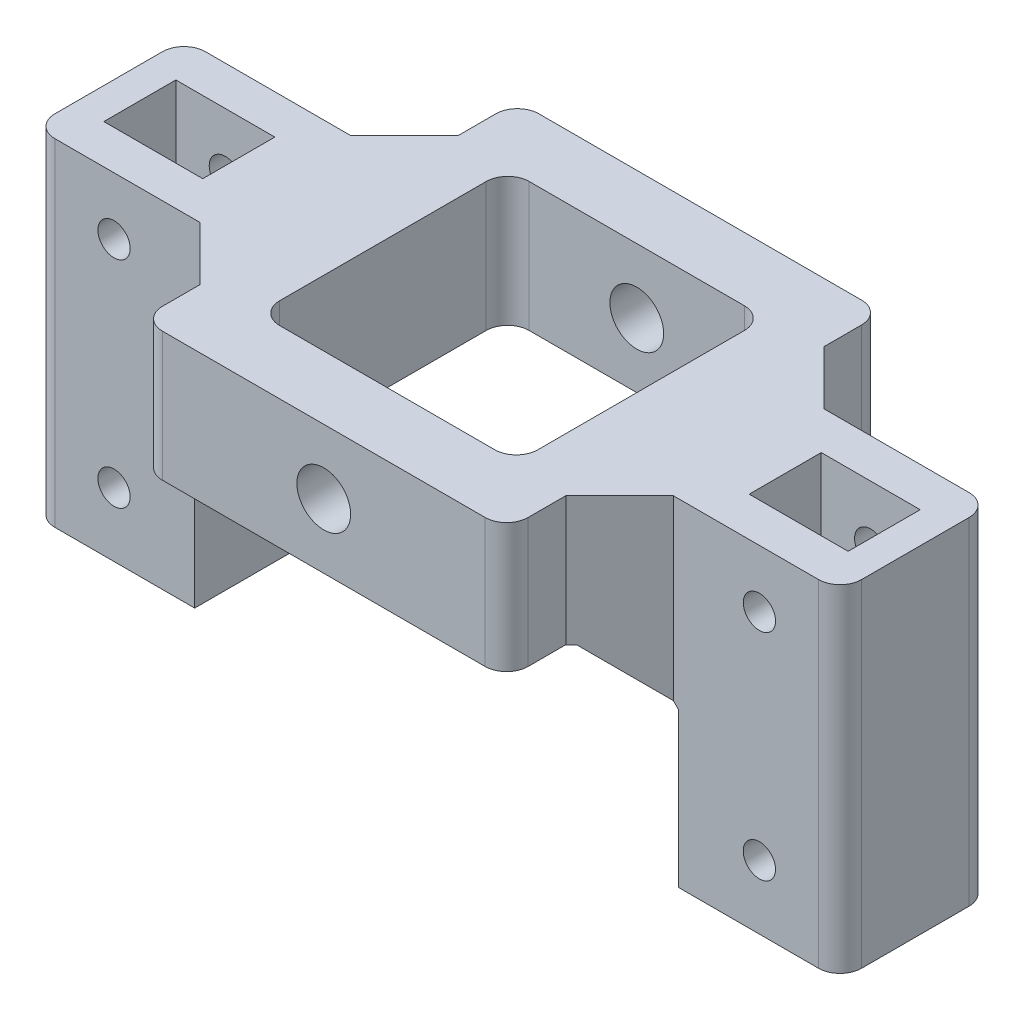
from build123d import *

# Parameters (mm, degrees)
EXTRUDE_1_DEPTH        = 7
EXTRUDE_1_DEPTH_BACK   = 7
SKETCH_1_W             = 15
SKETCH_1_H             = 34.3
EXTRUDE_1_2_DEPTH      = 7
EXTRUDE_1_2_DEPTH_BACK = 7
SKETCH_2_W             = 9.2
SKETCH_2_H             = 6.7
CUT_EXTRUDE_1_DEPTH    = 62
SKETCH_3_W             = 24
SKETCH_3_H             = 23.2
EXTRUDE_2_DEPTH        = 12
SKETCH_4_R             = 2.5
CUT_EXTRUDE_2_DEPTH    = 90
FILLET_1_R             = 2
CHAMFER_1_SIZE         = 5
CHAMFER_2_SIZE         = 5
FILLET_2_R             = 2
SKETCH_7_R             = 1.5
CUT_EXTRUDE_3_DEPTH    = 34
SKETCH_9_W             = 15
SKETCH_9_H             = 3
CUT_EXTRUDE_4_DEPTH    = 34


with BuildPart() as part:
    # 草图1 → 凸台-拉伸1 (new, two sides: drawn at the far end of the back side and taken through both)
    with BuildSketch(Plane.XY.offset(-EXTRUDE_1_DEPTH_BACK)):
        with Locations((30, 0)):
            Rectangle(SKETCH_1_W, SKETCH_1_H)
    extrude(amount=EXTRUDE_1_DEPTH + EXTRUDE_1_DEPTH_BACK)


with BuildPart() as body_2:
    # 草图1 → Extrude 1 2 (new, two sides: drawn at the far end of the back side and taken through both)
    with BuildSketch(Plane.XY.offset(-EXTRUDE_1_2_DEPTH_BACK)):
        with Locations((-30, 0)):
            Rectangle(SKETCH_1_W, SKETCH_1_H)
    extrude(amount=EXTRUDE_1_2_DEPTH + EXTRUDE_1_2_DEPTH_BACK)


with BuildPart() as cut_extrude_1_tool:
    # 草图2 → 切除-拉伸1 (new body)
    with BuildSketch(Plane(origin=(0, 17.15, 0), x_dir=(1, 0, 0), z_dir=(0, 1, 0))):
        with Locations((30, 0)):
            Rectangle(SKETCH_2_W, SKETCH_2_H)
        with Locations((-30, 0)):
            Rectangle(SKETCH_2_W, SKETCH_2_H)
    extrude(amount=-CUT_EXTRUDE_1_DEPTH)


with BuildPart() as part_1:
    add(part.part)

    # 切除-拉伸1: cut by cut_extrude_1_tool
    add(cut_extrude_1_tool.part, mode=Mode.SUBTRACT)



with BuildPart() as body_2_1:
    add(body_2.part)

    # 切除-拉伸1: cut by cut_extrude_1_tool
    add(cut_extrude_1_tool.part, mode=Mode.SUBTRACT)


with BuildPart() as part_2:
    add(part_1.part)

    add(body_2_1.part)  # 凸台-拉伸2 merges body 2
    # 草图3 → 凸台-拉伸2 (add)
    with BuildSketch(Plane(origin=(0, 17.15, 0), x_dir=(1, 0, 0), z_dir=(0, 1, 0))):
        Polygon((22.5, 7), (17, 7), (17, 17.5), (-17, 17.5), (-17, 7), (-22.5, 7), (-22.5, -7), (-17, -7), (-17, -17.5), (17, -17.5), (17, -7), (22.5, -7), align=None)
        Rectangle(SKETCH_3_W, SKETCH_3_H, mode=Mode.SUBTRACT)
    extrude(amount=-EXTRUDE_2_DEPTH)

    # 草图4 → 切除-拉伸2 (cut)
    with BuildSketch(Plane.XY.offset(17.5)):
        with Locations((0, 11.15)):
            Circle(SKETCH_4_R)
    extrude(amount=-CUT_EXTRUDE_2_DEPTH, mode=Mode.SUBTRACT)

    # 圆角1
    fillet_1_edges = [part_2.edges().sort_by_distance(p)[0] for p in [
        (-37.5, 0, -7),
        (-37.5, 0, 7),
        (37.5, 0, 7),
        (37.5, 0, -7),
    ]]
    fillet(fillet_1_edges, radius=FILLET_1_R)

    # 倒角1
    chamfer_1_edges = [part_2.edges().sort_by_distance(p)[0] for p in [
        (22.5, 5.15, 0),
        (-22.5, 5.15, 0),
    ]]
    chamfer(chamfer_1_edges, length=CHAMFER_1_SIZE)

    # 倒角2
    # the kernel refuses this chamfer: 5 mm, written as the material it adds along each edge
    with BuildSketch(Plane(origin=(17, 17.15, -7), x_dir=(0.9996219169112968, 0, 0.027495876610586147), z_dir=(0, -1, 0))) as chamfer_2_piece_1_section:
        Polygon((CHAMFER_2_SIZE * 0.999621916911, -CHAMFER_2_SIZE * 0.0274958766106), (-CHAMFER_2_SIZE * 0.0274958766106, -CHAMFER_2_SIZE * 0.999621916911), (0, 0), align=None)
    chamfer_2_piece_1 = extrude(amount=12, mode=Mode.PRIVATE)
    chamfer_2_piece_1 = split(chamfer_2_piece_1, bisect_by=Plane(origin=(15.061953737, 7.588046263, -8.643148294), z_dir=(0.7071067811865476, 0.7071067811865475, 0)), keep=Keep.TOP, mode=Mode.PRIVATE)
    add(chamfer_2_piece_1)
    with BuildSketch(Plane(origin=(17, 17.15, -7), x_dir=(0.9996219169112968, 0, 0.027495876610586147), z_dir=(0, -1, 0))) as chamfer_2_piece_2_section:
        Polygon((CHAMFER_2_SIZE * 0.999621916911, -CHAMFER_2_SIZE * 0.0274958766106), (-CHAMFER_2_SIZE * 0.0274958766106, -CHAMFER_2_SIZE * 0.999621916911), (0, 0), align=None)
    chamfer_2_piece_2 = extrude(amount=12, mode=Mode.PRIVATE)
    chamfer_2_piece_2 = split(chamfer_2_piece_2, bisect_by=Plane(origin=(17.181894142, 5.468105858, -9.627776216), z_dir=(-0.7071067811865476, -0.7071067811865475, 0)), keep=Keep.TOP, mode=Mode.PRIVATE)
    add(chamfer_2_piece_2)
    with BuildSketch(Plane(origin=(17, 17.15, -7), x_dir=(0.9996219169112968, 0, 0.027495876610586147), z_dir=(0, -1, 0))) as chamfer_2_piece_3_section:
        Polygon((CHAMFER_2_SIZE * 0.999621916911, -CHAMFER_2_SIZE * 0.0274958766106), (-CHAMFER_2_SIZE * 0.0274958766106, -CHAMFER_2_SIZE * 0.999621916911), (0, 0), align=None)
    chamfer_2_piece_3 = extrude(amount=24.85841494, mode=Mode.PRIVATE)
    chamfer_2_piece_3 = split(chamfer_2_piece_3, bisect_by=Plane(origin=(19.269171179, 3.380828821, -8.010149173), z_dir=(0.7071067811865476, 0.7071067811865475, 0)), keep=Keep.TOP, mode=Mode.PRIVATE)
    chamfer_2_piece_3 = split(chamfer_2_piece_3, bisect_by=Plane(origin=(19.858894906, 5.15, -8.010149173), z_dir=(0, -1, 0)), keep=Keep.TOP, mode=Mode.PRIVATE)
    add(chamfer_2_piece_3)
    with BuildSketch(Plane(origin=(-17, 17.15, -7), x_dir=(0.027495876610586313, 0, -0.9996219169112968), z_dir=(0, -1, 0))) as chamfer_2_piece_4_section:
        Polygon((CHAMFER_2_SIZE * 0.999621916911, -CHAMFER_2_SIZE * 0.0274958766106), (-CHAMFER_2_SIZE * 0.0274958766106, -CHAMFER_2_SIZE * 0.999621916911), (0, 0), align=None)
    chamfer_2_piece_4 = extrude(amount=12, mode=Mode.PRIVATE)
    chamfer_2_piece_4 = split(chamfer_2_piece_4, bisect_by=Plane(origin=(-15.061953737, 7.588046263, -8.643148294), z_dir=(-0.7071067811865475, 0.7071067811865476, 0)), keep=Keep.TOP, mode=Mode.PRIVATE)
    add(chamfer_2_piece_4)
    with BuildSketch(Plane(origin=(-17, 17.15, -7), x_dir=(0.027495876610586313, 0, -0.9996219169112968), z_dir=(0, -1, 0))) as chamfer_2_piece_5_section:
        Polygon((CHAMFER_2_SIZE * 0.999621916911, -CHAMFER_2_SIZE * 0.0274958766106), (-CHAMFER_2_SIZE * 0.0274958766106, -CHAMFER_2_SIZE * 0.999621916911), (0, 0), align=None)
    chamfer_2_piece_5 = extrude(amount=24.85841494, mode=Mode.PRIVATE)
    chamfer_2_piece_5 = split(chamfer_2_piece_5, bisect_by=Plane(origin=(-19.858894906, 5.15, -8.010149173), z_dir=(0, -1, 0)), keep=Keep.TOP, mode=Mode.PRIVATE)
    chamfer_2_piece_5 = split(chamfer_2_piece_5, bisect_by=Plane(origin=(-19.269171179, 3.380828821, -8.010149173), z_dir=(-0.7071067811865475, 0.7071067811865476, 0)), keep=Keep.TOP, mode=Mode.PRIVATE)
    add(chamfer_2_piece_5)
    with BuildSketch(Plane(origin=(-17, 17.15, -7), x_dir=(0.027495876610586313, 0, -0.9996219169112968), z_dir=(0, -1, 0))) as chamfer_2_piece_6_section:
        Polygon((CHAMFER_2_SIZE * 0.999621916911, -CHAMFER_2_SIZE * 0.0274958766106), (-CHAMFER_2_SIZE * 0.0274958766106, -CHAMFER_2_SIZE * 0.999621916911), (0, 0), align=None)
    chamfer_2_piece_6 = extrude(amount=12, mode=Mode.PRIVATE)
    chamfer_2_piece_6 = split(chamfer_2_piece_6, bisect_by=Plane(origin=(-17.181894142, 5.468105858, -9.627776216), z_dir=(0.7071067811865475, -0.7071067811865476, 0)), keep=Keep.TOP, mode=Mode.PRIVATE)
    add(chamfer_2_piece_6)
    with BuildSketch(Plane(origin=(17, 17.15, 7), x_dir=(0.9996219169112968, 0, -0.027495876610586147), z_dir=(0, -1, 0))) as chamfer_2_piece_7_section:
        Polygon((CHAMFER_2_SIZE * 0.999621916911, CHAMFER_2_SIZE * 0.0274958766106), (-CHAMFER_2_SIZE * 0.0274958766106, CHAMFER_2_SIZE * 0.999621916911), (0, 0), align=None)
    chamfer_2_piece_7 = extrude(amount=12, mode=Mode.PRIVATE)
    chamfer_2_piece_7 = split(chamfer_2_piece_7, bisect_by=Plane(origin=(15.061953737, 7.588046263, 8.643148294), z_dir=(0.7071067811865476, 0.7071067811865475, 0)), keep=Keep.TOP, mode=Mode.PRIVATE)
    add(chamfer_2_piece_7)
    with BuildSketch(Plane(origin=(17, 17.15, 7), x_dir=(0.9996219169112968, 0, -0.027495876610586147), z_dir=(0, -1, 0))) as chamfer_2_piece_8_section:
        Polygon((CHAMFER_2_SIZE * 0.999621916911, CHAMFER_2_SIZE * 0.0274958766106), (-CHAMFER_2_SIZE * 0.0274958766106, CHAMFER_2_SIZE * 0.999621916911), (0, 0), align=None)
    chamfer_2_piece_8 = extrude(amount=12, mode=Mode.PRIVATE)
    chamfer_2_piece_8 = split(chamfer_2_piece_8, bisect_by=Plane(origin=(17.181894142, 5.468105858, 9.627776216), z_dir=(-0.7071067811865476, -0.7071067811865475, 0)), keep=Keep.TOP, mode=Mode.PRIVATE)
    add(chamfer_2_piece_8)
    with BuildSketch(Plane(origin=(17, 17.15, 7), x_dir=(0.9996219169112968, 0, -0.027495876610586147), z_dir=(0, -1, 0))) as chamfer_2_piece_9_section:
        Polygon((CHAMFER_2_SIZE * 0.999621916911, CHAMFER_2_SIZE * 0.0274958766106), (-CHAMFER_2_SIZE * 0.0274958766106, CHAMFER_2_SIZE * 0.999621916911), (0, 0), align=None)
    chamfer_2_piece_9 = extrude(amount=24.85841494, mode=Mode.PRIVATE)
    chamfer_2_piece_9 = split(chamfer_2_piece_9, bisect_by=Plane(origin=(19.269171179, 3.380828821, 8.010149173), z_dir=(0.7071067811865476, 0.7071067811865475, 0)), keep=Keep.TOP, mode=Mode.PRIVATE)
    chamfer_2_piece_9 = split(chamfer_2_piece_9, bisect_by=Plane(origin=(19.858894906, 5.15, 8.010149173), z_dir=(0, -1, 0)), keep=Keep.TOP, mode=Mode.PRIVATE)
    add(chamfer_2_piece_9)
    with BuildSketch(Plane(origin=(-17, 17.15, 7), x_dir=(0.027495876610586313, 0, 0.9996219169112968), z_dir=(0, -1, 0))) as chamfer_2_piece_10_section:
        Polygon((CHAMFER_2_SIZE * 0.999621916911, CHAMFER_2_SIZE * 0.0274958766106), (-CHAMFER_2_SIZE * 0.0274958766106, CHAMFER_2_SIZE * 0.999621916911), (0, 0), align=None)
    chamfer_2_piece_10 = extrude(amount=12, mode=Mode.PRIVATE)
    chamfer_2_piece_10 = split(chamfer_2_piece_10, bisect_by=Plane(origin=(-15.061953737, 7.588046263, 8.643148294), z_dir=(-0.7071067811865475, 0.7071067811865476, 0)), keep=Keep.TOP, mode=Mode.PRIVATE)
    add(chamfer_2_piece_10)
    with BuildSketch(Plane(origin=(-17, 17.15, 7), x_dir=(0.027495876610586313, 0, 0.9996219169112968), z_dir=(0, -1, 0))) as chamfer_2_piece_11_section:
        Polygon((CHAMFER_2_SIZE * 0.999621916911, CHAMFER_2_SIZE * 0.0274958766106), (-CHAMFER_2_SIZE * 0.0274958766106, CHAMFER_2_SIZE * 0.999621916911), (0, 0), align=None)
    chamfer_2_piece_11 = extrude(amount=24.85841494, mode=Mode.PRIVATE)
    chamfer_2_piece_11 = split(chamfer_2_piece_11, bisect_by=Plane(origin=(-19.858894906, 5.15, 8.010149173), z_dir=(0, -1, 0)), keep=Keep.TOP, mode=Mode.PRIVATE)
    chamfer_2_piece_11 = split(chamfer_2_piece_11, bisect_by=Plane(origin=(-19.269171179, 3.380828821, 8.010149173), z_dir=(-0.7071067811865475, 0.7071067811865476, 0)), keep=Keep.TOP, mode=Mode.PRIVATE)
    add(chamfer_2_piece_11)
    with BuildSketch(Plane(origin=(-17, 17.15, 7), x_dir=(0.027495876610586313, 0, 0.9996219169112968), z_dir=(0, -1, 0))) as chamfer_2_piece_12_section:
        Polygon((CHAMFER_2_SIZE * 0.999621916911, CHAMFER_2_SIZE * 0.0274958766106), (-CHAMFER_2_SIZE * 0.0274958766106, CHAMFER_2_SIZE * 0.999621916911), (0, 0), align=None)
    chamfer_2_piece_12 = extrude(amount=12, mode=Mode.PRIVATE)
    chamfer_2_piece_12 = split(chamfer_2_piece_12, bisect_by=Plane(origin=(-17.181894142, 5.468105858, 9.627776216), z_dir=(0.7071067811865475, -0.7071067811865476, 0)), keep=Keep.TOP, mode=Mode.PRIVATE)
    add(chamfer_2_piece_12)

    # 圆角2
    fillet_2_edges = [part_2.edges().sort_by_distance(p)[0] for p in [
        (17, 11.15, 17.5),
        (-17, 11.15, 17.5),
        (-17, 11.15, -17.5),
        (17, 11.15, -17.5),
        (12, 11.15, 11.6),
        (-12, 11.15, 11.6),
        (-12, 11.15, -11.6),
        (12, 11.15, -11.6),
    ]]
    fillet(fillet_2_edges, radius=FILLET_2_R)

    # 草图7 → 切除-拉伸3 (cut)
    with BuildSketch(Plane.XY.offset(7)):
        with Locations(Location((30, 11.8, 0), (0, 0, 180))):
            Circle(SKETCH_7_R)
        with Locations(Location((30, -8.2, 0), (0, 0, 180))):
            Circle(SKETCH_7_R)
        with Locations(Location((-30, -8.2, 0), (0, 0, 180))):
            Circle(SKETCH_7_R)
        with Locations(Location((-30, 11.8, 0), (0, 0, 180))):
            Circle(SKETCH_7_R)
    extrude(amount=-CUT_EXTRUDE_3_DEPTH, mode=Mode.SUBTRACT)

    # 草图9 → 切除-拉伸4 (cut)
    with BuildSketch(Plane.XY.offset(7)):
        with Locations((-30, -15.65)):
            Rectangle(SKETCH_9_W, SKETCH_9_H)
        with Locations((30, -15.65)):
            Rectangle(SKETCH_9_W, SKETCH_9_H)
    extrude(amount=-CUT_EXTRUDE_4_DEPTH, mode=Mode.SUBTRACT)


solid = part_2.part
